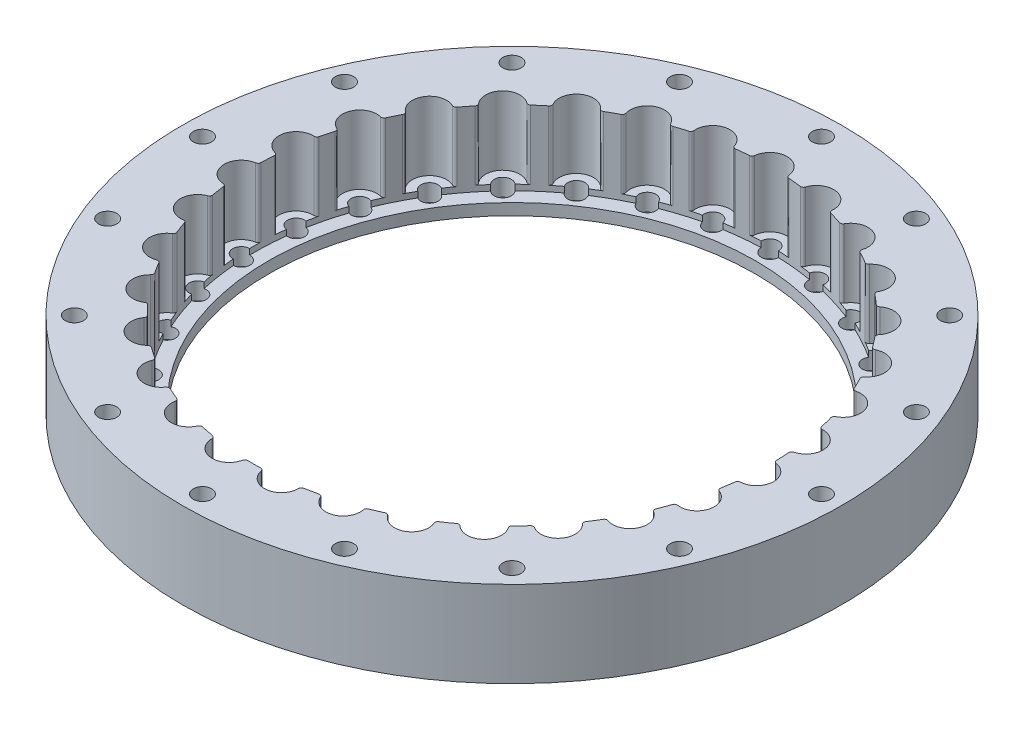
from build123d import *

# Parameters (mm, degrees)
SKETCH1_R                = 57.5
SKETCH1_R_2              = 45
BOSS_EXTRUDE1_DEPTH      = 12
BOSS_EXTRUDE2_START      = 1
SKETCH2_R                = 57.5
SKETCH2_R_2              = 45
BOSS_EXTRUDE2_DEPTH      = 1
BOSS_EXTRUDE3_START      = 2
SKETCH3_R                = 57.5
SKETCH3_R_2              = 42.5
BOSS_EXTRUDE3_DEPTH      = 2
SKETCH5_R                = 3
CUT_EXTRUDE2_DEPTH       = 12
FILLET4_R                = 0.5
SKETCH7_R                = 1.5
CUT_EXTRUDE3_DEPTH       = 10
CIRPATTERN3_COUNT        = 31
FILLET4_OF_CIRPATTERN3_R = 0.5
SKETCH4_R                = 1.6
CUT_EXTRUDE1_DEPTH       = 51


with BuildPart() as part:
    # Sketch1 → Boss-Extrude1 (new body)
    with BuildSketch(Plane(origin=(0, 0, 0), x_dir=(1, 0, 0), z_dir=(0, 1, 0))):
        Circle(SKETCH1_R)
        Circle(SKETCH1_R_2, mode=Mode.SUBTRACT)
    extrude(amount=BOSS_EXTRUDE1_DEPTH)

    # Sketch2 → Boss-Extrude2 (add)
    with BuildSketch(Plane.XZ.offset(BOSS_EXTRUDE2_START)):
        Circle(SKETCH2_R)
        Circle(SKETCH2_R_2, mode=Mode.SUBTRACT)
    extrude(amount=-BOSS_EXTRUDE2_DEPTH)

    # Sketch3 → Boss-Extrude3 (add)
    with BuildSketch(Plane.XZ.offset(1).offset(BOSS_EXTRUDE3_START)):
        Circle(SKETCH3_R)
        Circle(SKETCH3_R_2, mode=Mode.SUBTRACT)
    extrude(amount=-BOSS_EXTRUDE3_DEPTH)

    # Sketch5 → Cut-Extrude2 (cut)
    with BuildSketch(Plane(origin=(0, 12, 0), x_dir=(1, 0, 0), z_dir=(0, 1, 0))):
        with Locations((0, 45)):
            Circle(SKETCH5_R)
    cut_extrude2 = extrude(amount=-CUT_EXTRUDE2_DEPTH, mode=Mode.SUBTRACT)

    # Fillet4
    fillet4_edges = [part.edges().sort_by_distance(p)[0] for p in [
        (2.99833287, 6, -44.9),
        (-2.99833287, 6, -44.9),
    ]]
    fillet(fillet4_edges, radius=FILLET4_R)

    # Sketch7 → Cut-Extrude3 (cut)
    with BuildSketch(Plane(origin=(0, 0, 0), x_dir=(1, 0, 0), z_dir=(0, 1, 0))):
        with Locations((0, 45)):
            Circle(SKETCH7_R)
    cut_extrude3 = extrude(amount=-CUT_EXTRUDE3_DEPTH, mode=Mode.SUBTRACT)

    # CirPattern3: Cut-Extrude2, Cut-Extrude3 ×31 about axis
    cirpattern3_axis = Axis((0, -3, 0), (0, 1, 0))
    add([cut_extrude2.rotate(cirpattern3_axis, i * 360 / CIRPATTERN3_COUNT) for i in range(1, CIRPATTERN3_COUNT)], mode=Mode.SUBTRACT)
    add([cut_extrude3.rotate(cirpattern3_axis, i * 360 / CIRPATTERN3_COUNT) for i in range(1, CIRPATTERN3_COUNT)], mode=Mode.SUBTRACT)

    # Fillet4 of CirPattern3
    fillet4_of_cirpattern3_edges = [part.edges().sort_by_distance(p)[0] for p in [
        (-6.101346732, 6, -44.584454332),
        (-11.975260372, 6, -43.377334393),
        (-14.951236482, 6, -42.443615865),
        (-20.461919307, 6, -40.078795619),
        (-23.189020853, 6, -38.565130777),
        (-28.110864862, 6, -35.139426243),
        (-30.477443987, 6, -33.107784704),
        (-34.608948306, 6, -28.761444629),
        (-36.518116982, 6, -26.295002036),
        (-39.690137341, 6, -21.205966091),
        (-41.063733978, 6, -18.405698895),
        (-43.146407489, 6, -12.782312811),
        (-43.92819688, 6, -9.762864278),
        (-44.836258645, 6, -3.835350142),
        (-44.99423424, 6, -0.720336851),
        (-44.690508104, 6, 5.268632212),
        (-44.218202364, 6, 8.351681252),
        (-42.715122911, 6, 14.156916145),
        (-41.631872087, 6, 17.081780543),
        (-38.990975566, 6, 22.465614267),
        (-37.341128076, 6, 25.112549731),
        (-33.670533101, 6, 29.854567501),
        (-31.521633894, 6, 32.115208183),
        (-26.971615054, 6, 36.021271235),
        (-24.411640317, 6, 37.803066239),
        (-19.168475919, 6, 40.713259891),
        (-16.302231317, 6, 41.943262321),
        (-10.580577126, 6, 43.738442904),
        (-7.525407051, 6, 44.366296315),
        (-1.559508263, 6, 44.972968926),
        (1.559508263, 6, 44.972968926),
        (7.525407051, 6, 44.366296315),
        (10.580577126, 6, 43.738442904),
        (16.302231317, 6, 41.943262321),
        (19.168475919, 6, 40.713259891),
        (24.411640317, 6, 37.803066239),
        (26.971615054, 6, 36.021271235),
        (31.521633894, 6, 32.115208183),
        (33.670533101, 6, 29.854567501),
        (37.341128076, 6, 25.112549731),
        (38.990975566, 6, 22.465614267),
        (41.631872087, 6, 17.081780543),
        (42.715122911, 6, 14.156916145),
        (44.218202364, 6, 8.351681252),
        (44.690508104, 6, 5.268632212),
        (44.99423424, 6, -0.720336851),
        (44.836258645, 6, -3.835350142),
        (43.92819688, 6, -9.762864278),
        (43.146407489, 6, -12.782312811),
        (41.063733978, 6, -18.405698895),
        (39.690137341, 6, -21.205966091),
        (36.518116982, 6, -26.295002036),
        (34.608948306, 6, -28.761444629),
        (30.477443987, 6, -33.107784704),
        (28.110864862, 6, -35.139426243),
        (23.189020853, 6, -38.565130777),
        (20.461919307, 6, -40.078795619),
        (14.951236482, 6, -42.443615865),
        (11.975260372, 6, -43.377334393),
        (6.101346732, 6, -44.584454332),
    ]]
    fillet(fillet4_of_cirpattern3_edges, radius=FILLET4_OF_CIRPATTERN3_R)

    # Sketch4 → Cut-Extrude1 (cut)
    with BuildSketch(Plane(origin=(0, 12, 0), x_dir=(1, 0, 0), z_dir=(0, 1, 0))):
        with Locations((0, 54)):
            Circle(SKETCH4_R)
        with Locations((20.664905348, 49.889494756)):
            Circle(SKETCH4_R)
        with Locations((38.183766184, 38.183766184)):
            Circle(SKETCH4_R)
        with Locations((49.889494756, 20.664905348)):
            Circle(SKETCH4_R)
        with Locations((54, 0)):
            Circle(SKETCH4_R)
        with Locations((49.889494756, -20.664905348)):
            Circle(SKETCH4_R)
        with Locations((38.183766184, -38.183766184)):
            Circle(SKETCH4_R)
        with Locations((20.664905348, -49.889494756)):
            Circle(SKETCH4_R)
        with Locations((0, -54)):
            Circle(SKETCH4_R)
        with Locations((-20.664905348, -49.889494756)):
            Circle(SKETCH4_R)
        with Locations((-38.183766184, -38.183766184)):
            Circle(SKETCH4_R)
        with Locations((-49.889494756, -20.664905348)):
            Circle(SKETCH4_R)
        with Locations((-54, 0)):
            Circle(SKETCH4_R)
        with Locations((-49.889494756, 20.664905348)):
            Circle(SKETCH4_R)
        with Locations((-38.183766184, 38.183766184)):
            Circle(SKETCH4_R)
        with Locations((-20.664905348, 49.889494756)):
            Circle(SKETCH4_R)
    extrude(amount=-CUT_EXTRUDE1_DEPTH, mode=Mode.SUBTRACT)


solid = part.part
